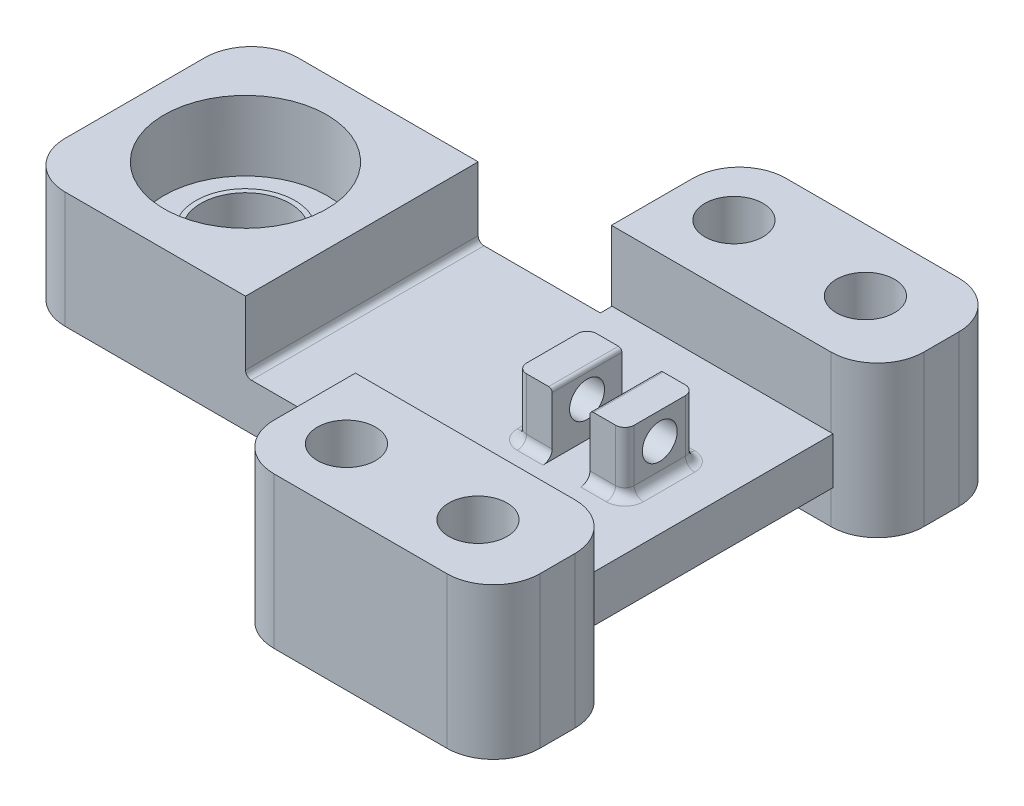
from build123d import *

# Parameters (mm, degrees)
SKETCH2_W            = 49
SKETCH2_H            = 20
BOSS_EXTRUDE1_DEPTH  = 10
SKETCH3_W            = 30
SKETCH3_H            = 3.02
CUT_EXTRUDE1_DEPTH   = 2
SKETCH4_W            = 5
SKETCH4_H            = 6
CUT_EXTRUDE2_DEPTH   = 5
SKETCH5_R            = 7
CUT_EXTRUDE3_DEPTH   = 38.474986727
SKETCH12_W           = 5
SKETCH12_H           = 6
BOSS_EXTRUDE4_DEPTH  = 0.8
SKETCH14_W           = 29.5
SKETCH14_H           = 6
CUT_EXTRUDE6_DEPTH   = 42.177221974
SKETCH20_W           = 5
SKETCH20_H           = 6
BOSS_EXTRUDE6_DEPTH  = 4.2
SKETCH21_R           = 4.6
CUT_EXTRUDE8_DEPTH   = 0.5
SKETCH22_R           = 3.825
CUT_EXTRUDE9_DEPTH   = 4
SKETCH24_R           = 4.6
SKETCH24_R_2         = 4.25
CUT_EXTRUDE11_DEPTH  = 1
BOSS_EXTRUDE9_START  = 0.5
SKETCH26_R           = 4.25
SKETCH26_R_2         = 3.825
BOSS_EXTRUDE9_DEPTH  = 0.5
SKETCH27_R           = 7
SKETCH27_R_2         = 4.6
CUT_EXTRUDE12_DEPTH  = 1
FILLET1_R            = 0.5
SKETCH56_R           = 2
CUT_EXTRUDE13_DEPTH  = 2
SKETCH57_W           = 3
SKETCH57_H           = 6
BOSS_EXTRUDE19_DEPTH = 5.3
CUT_EXTRUDE14_REACH  = 50.148
SKETCH58_R           = 1.5
FILLET2_R            = 0.3
FILLET3_R            = 0.8
SKETCH60_W           = 19
SKETCH60_H           = 4
BOSS_EXTRUDE21_DEPTH = 1
SKETCH59_W           = 22.86
SKETCH59_H           = 13
BOSS_EXTRUDE20_DEPTH = 11
CUT_EXTRUDE15_REACH  = 49.914
SKETCH61_R           = 2.5
FILLET4_R            = 4


with BuildPart() as part:
    # Sketch2 → Boss-Extrude1 (new body)
    with BuildSketch(Plane(origin=(0, 0, 0), x_dir=(1, 0, 0), z_dir=(0, 1, 0))):
        with Locations((10.076923077, 3.557692308)):
            Rectangle(SKETCH2_W, SKETCH2_H)
    extrude(amount=BOSS_EXTRUDE1_DEPTH)

    # Sketch3 → Cut-Extrude1 (cut)
    with BuildSketch(Plane.XZ):
        with Locations((12.576923077, -3.557692308)):
            Rectangle(SKETCH3_W, SKETCH3_H)
    extrude(amount=-CUT_EXTRUDE1_DEPTH, mode=Mode.SUBTRACT)

    # Sketch4 → Cut-Extrude2 (cut)
    with BuildSketch(Plane.XZ):
        with Locations((-4.923076923, -3.547692308)):
            Rectangle(SKETCH4_W, SKETCH4_H)
    extrude(amount=-CUT_EXTRUDE2_DEPTH, mode=Mode.SUBTRACT)

    # Sketch5 → Cut-Extrude3 (cut, through all)
    with BuildSketch(Plane.XZ.offset(-5)):
        with Locations(Location((-4.923076923, -3.552692308, 0), (0, 0, 270))):
            Circle(SKETCH5_R)
    extrude(amount=-CUT_EXTRUDE3_DEPTH, mode=Mode.SUBTRACT)

    # Sketch12 → Boss-Extrude4 (add)
    with BuildSketch(Plane.XZ):
        with Locations((-4.923076923, -3.547692308)):
            Rectangle(SKETCH12_W, SKETCH12_H)
    extrude(amount=-BOSS_EXTRUDE4_DEPTH)

    # Sketch14 → Cut-Extrude6 (cut, through all)
    with BuildSketch(Plane.XY.offset(6.442307692)):
        with Locations((19.826923077, 7)):
            Rectangle(SKETCH14_W, SKETCH14_H)
    extrude(amount=-CUT_EXTRUDE6_DEPTH, mode=Mode.SUBTRACT)

    # Sketch20 → Boss-Extrude6 (add)
    with BuildSketch(Plane(origin=(0, 0.8, 0), x_dir=(1, 0, 0), z_dir=(0, 1, 0))):
        with Locations((-4.923076923, 3.547692308)):
            Rectangle(SKETCH20_W, SKETCH20_H)
    extrude(amount=BOSS_EXTRUDE6_DEPTH)

    # Sketch21 → Cut-Extrude8 (cut)
    with BuildSketch(Plane(origin=(0, 5, 0), x_dir=(1, 0, 0), z_dir=(0, 1, 0))):
        with Locations(Location((-4.923076923, 3.552692308, 0), (0, 0, 270))):
            Circle(SKETCH21_R)
    extrude(amount=-CUT_EXTRUDE8_DEPTH, mode=Mode.SUBTRACT)

    # Sketch22 → Cut-Extrude9 (cut)
    with BuildSketch(Plane(origin=(0, 4.5, 0), x_dir=(1, 0, 0), z_dir=(0, 1, 0))):
        with Locations(Location((-4.923076923, 3.552692308, 0), (0, 0, 270))):
            Circle(SKETCH22_R)
    extrude(amount=-CUT_EXTRUDE9_DEPTH, mode=Mode.SUBTRACT)

    # Sketch24 → Cut-Extrude11 (cut)
    with BuildSketch(Plane(origin=(0, 5, 0), x_dir=(1, 0, 0), z_dir=(0, 1, 0))):
        with Locations(Location((-4.923076923, 3.552692308, 0), (0, 0, 270))):
            Circle(SKETCH24_R)
        with Locations(Location((-4.923076923, 3.552692308, 0), (0, 0, 270))):
            Circle(SKETCH24_R_2, mode=Mode.SUBTRACT)
    extrude(amount=-CUT_EXTRUDE11_DEPTH, mode=Mode.SUBTRACT)

    # Sketch26 → Boss-Extrude9 (add)
    with BuildSketch(Plane(origin=(0, 4.5, 0), x_dir=(1, 0, 0), z_dir=(0, 1, 0)).offset(BOSS_EXTRUDE9_START)):
        with Locations(Location((-4.923076923, 3.552692308, 0), (0, 0, 270))):
            Circle(SKETCH26_R)
        with Locations(Location((-4.923076923, 3.552692308, 0), (0, 0, 270))):
            Circle(SKETCH26_R_2, mode=Mode.SUBTRACT)
    extrude(amount=-BOSS_EXTRUDE9_DEPTH)

    # Sketch27 → Cut-Extrude12 (cut)
    with BuildSketch(Plane(origin=(0, 5, 0), x_dir=(1, 0, 0), z_dir=(0, 1, 0))):
        with Locations(Location((-4.923076923, 3.552692308, 0), (0, 0, 90))):
            Circle(SKETCH27_R)
        with Locations((-4.923076923, 3.552692308)):
            Circle(SKETCH27_R_2, mode=Mode.SUBTRACT)
    extrude(amount=-CUT_EXTRUDE12_DEPTH, mode=Mode.SUBTRACT)

    # Fillet1
    fillet1_edges = [part.edges().sort_by_distance(p)[0] for p in [
        (5.076923077, 4, -3.557692308),
    ]]
    fillet(fillet1_edges, radius=FILLET1_R)

    # Sketch56 → Cut-Extrude13 (cut)
    with BuildSketch(Plane.XZ):
        with Locations((28.926923077, -3.557692308)):
            Circle(SKETCH56_R)
    extrude(amount=-CUT_EXTRUDE13_DEPTH, mode=Mode.SUBTRACT)

    # Sketch57 → Boss-Extrude19 (add)
    with BuildSketch(Plane(origin=(0, 4, 0), x_dir=(1, 0, 0), z_dir=(0, 1, 0))):
        with Locations((29.181923077, 3.557692308)):
            Rectangle(SKETCH57_W, SKETCH57_H)
        with Locations((22.931923077, 3.557692308)):
            Rectangle(SKETCH57_W, SKETCH57_H)
    extrude(amount=BOSS_EXTRUDE19_DEPTH)

    # Cut-Extrude14: up to this face of the body (flat: up to its plane)
    cut_extrude14_end = Plane(part.part.faces().sort_by_distance((21.431923077, 6.65, -3.557692308))[0])
    # Sketch58 → Cut-Extrude14 (cut, up to the picked face)
    with BuildSketch(Plane(origin=(30.681923077, 0, 0), x_dir=(0, 0, -1), z_dir=(1, 0, 0)), mode=Mode.PRIVATE) as cut_extrude14_sk1:
        with Locations(Location((3.557692308, 7, 0), (0, 0, 180))):
            Circle(SKETCH58_R)
    cut_extrude14_tool1 = split(extrude(cut_extrude14_sk1.sketch, amount=-CUT_EXTRUDE14_REACH, mode=Mode.PRIVATE), bisect_by=cut_extrude14_end, keep=Keep.BOTH, mode=Mode.PRIVATE)
    add(cut_extrude14_tool1.solids().sort_by(Axis((30.681923, 7, -3.557692), (-1, 0, 0)))[0], mode=Mode.SUBTRACT)

    # Fillet2
    fillet2_edges = [part.edges().sort_by_distance(p)[0] for p in [
        (27.681923077, 9.3, -3.557692308),
        (24.431923077, 9.3, -3.557692308),
    ]]
    fillet(fillet2_edges, radius=FILLET2_R)

    # Fillet3
    fillet3_edges = [part.edges().sort_by_distance(p)[0] for p in [
        (30.681923077, 4, -3.557692308),
        (30.681923077, 6.65, -0.557692308),
        (29.181923077, 4, -6.557692308),
        (30.681923077, 6.65, -6.557692308),
        (29.181923077, 4, -0.557692308),
        (21.431923077, 6.65, -6.557692308),
        (21.431923077, 6.65, -0.557692308),
        (22.931923077, 4, -6.557692308),
        (21.431923077, 4, -3.557692308),
        (22.931923077, 4, -0.557692308),
    ]]
    fillet(fillet3_edges, radius=FILLET3_R)

    # Sketch60 → Boss-Extrude21 (add)
    with BuildSketch(Plane(origin=(0, 0, -13.557692308), x_dir=(-1, 0, 0), z_dir=(0, 0, -1))):
        with Locations((-25.076923077, 2)):
            Rectangle(SKETCH60_W, SKETCH60_H)
    boss_extrude21 = extrude(amount=BOSS_EXTRUDE21_DEPTH)

    # Sketch59 → Boss-Extrude20 (add)
    with BuildSketch(Plane(origin=(0, 0, -14.557692308), x_dir=(-1, 0, 0), z_dir=(0, 0, -1))):
        with Locations((-26.956923077, 3.5)):
            Rectangle(SKETCH59_W, SKETCH59_H)
    boss_extrude20 = extrude(amount=BOSS_EXTRUDE20_DEPTH)

    # Mirror4: Boss-Extrude21, Boss-Extrude20 across plane
    add(boss_extrude21.mirror(Plane(origin=(0, 0, -3.557692308), x_dir=(1, 0, 0), z_dir=(0, 0, -1))))
    add(boss_extrude20.mirror(Plane(origin=(0, 0, -3.557692308), x_dir=(1, 0, 0), z_dir=(0, 0, -1))))

    # Sketch61 → Cut-Extrude15 (cut, up to next)
    with BuildSketch(Plane(origin=(0, 10, 0), x_dir=(1, 0, 0), z_dir=(0, 1, 0)), mode=Mode.PRIVATE) as cut_extrude15_sk1:
        with Locations(Location((20.406923077, 20.207692308, 0), (0, 0, 270))):
            Circle(SKETCH61_R)
    cut_extrude15_tool1 = extrude(cut_extrude15_sk1.sketch, amount=-CUT_EXTRUDE15_REACH, mode=Mode.PRIVATE) & part.part
    # Sketch61 → Cut-Extrude15 (cut, up to next)
    with BuildSketch(Plane(origin=(0, 10, 0), x_dir=(1, 0, 0), z_dir=(0, 1, 0)), mode=Mode.PRIVATE) as cut_extrude15_sk2:
        with Locations(Location((31.706923077, 20.207692308, 0), (0, 0, 270))):
            Circle(SKETCH61_R)
    cut_extrude15_tool2 = extrude(cut_extrude15_sk2.sketch, amount=-CUT_EXTRUDE15_REACH, mode=Mode.PRIVATE) & part.part
    # Sketch61 → Cut-Extrude15 (cut, up to next)
    with BuildSketch(Plane(origin=(0, 10, 0), x_dir=(1, 0, 0), z_dir=(0, 1, 0)), mode=Mode.PRIVATE) as cut_extrude15_sk3:
        with Locations(Location((31.706923077, -13.092307692, 0), (0, 0, 90))):
            Circle(SKETCH61_R)
    cut_extrude15_tool3 = extrude(cut_extrude15_sk3.sketch, amount=-CUT_EXTRUDE15_REACH, mode=Mode.PRIVATE) & part.part
    # Sketch61 → Cut-Extrude15 (cut, up to next)
    with BuildSketch(Plane(origin=(0, 10, 0), x_dir=(1, 0, 0), z_dir=(0, 1, 0)), mode=Mode.PRIVATE) as cut_extrude15_sk4:
        with Locations(Location((20.406923077, -13.092307692, 0), (0, 0, 90))):
            Circle(SKETCH61_R)
    cut_extrude15_tool4 = extrude(cut_extrude15_sk4.sketch, amount=-CUT_EXTRUDE15_REACH, mode=Mode.PRIVATE) & part.part
    add(cut_extrude15_tool1.solids().sort_by_distance((20.406923, 10, -20.207692))[0], mode=Mode.SUBTRACT)
    add(cut_extrude15_tool2.solids().sort_by_distance((31.706923, 10, -20.207692))[0], mode=Mode.SUBTRACT)
    add(cut_extrude15_tool3.solids().sort_by_distance((31.706923, 10, 13.092308))[0], mode=Mode.SUBTRACT)
    add(cut_extrude15_tool4.solids().sort_by_distance((20.406923, 10, 13.092308))[0], mode=Mode.SUBTRACT)

    # Fillet4
    # the kernel refuses this fillet: 4 mm, written as the material it takes off along each edge
    with BuildSketch(Plane(origin=(38.386923077, 20, -25.557692308), x_dir=(0, 0, 1), z_dir=(0, -1, 0)), Plane(origin=(15.526923077, -13, 18.442307692), x_dir=(1, 0, 0), z_dir=(0, 1, 0)), Plane(origin=(15.526923077, -13, -25.557692308), x_dir=(0, 0, 1), z_dir=(0, 1, 0))) as fillet4_piece_1:
        with BuildLine():
            CenterArc((FILLET4_R, FILLET4_R), FILLET4_R, 180, 90)
            Line((0, FILLET4_R), (0, 0))
            Line((0, 0), (FILLET4_R, 0))
        make_face()
    extrude(amount=33, mode=Mode.SUBTRACT)
    with BuildSketch(Plane(origin=(38.386923077, 20, 7.442307692), x_dir=(0, 0, 1), z_dir=(0, -1, 0))) as fillet4_piece_2_section:
        with BuildLine():
            CenterArc((FILLET4_R, FILLET4_R), FILLET4_R, 180, 90)
            Line((0, FILLET4_R), (0, 0))
            Line((0, 0), (FILLET4_R, 0))
        make_face()
    fillet4_piece_2 = extrude(amount=33, mode=Mode.PRIVATE)
    fillet4_piece_2 = split(fillet4_piece_2, bisect_by=Plane(origin=(34.576923077, 12, 8.351487897), z_dir=(1, 0, 0)), keep=Keep.TOP, mode=Mode.PRIVATE)
    fillet4_piece_2 = split(fillet4_piece_2, bisect_by=Plane(origin=(37.49276705, 4, 8.351487897), z_dir=(0, 1, 0)), keep=Keep.TOP, mode=Mode.PRIVATE)
    add(fillet4_piece_2, mode=Mode.SUBTRACT)
    with BuildSketch(Plane(origin=(38.386923077, 20, 7.442307692), x_dir=(0, 0, 1), z_dir=(0, -1, 0))) as fillet4_piece_3_section:
        with BuildLine():
            CenterArc((FILLET4_R, FILLET4_R), FILLET4_R, 180, 90)
            Line((0, FILLET4_R), (0, 0))
            Line((0, 0), (FILLET4_R, 0))
        make_face()
    fillet4_piece_3 = extrude(amount=33, mode=Mode.PRIVATE)
    fillet4_piece_3 = split(fillet4_piece_3, bisect_by=Plane(origin=(34.576923077, 12, 7.403071145), z_dir=(-1, 0, 0)), keep=Keep.TOP, mode=Mode.PRIVATE)
    fillet4_piece_3 = split(fillet4_piece_3, bisect_by=Plane(origin=(34.482800084, 4, 7.403071145), z_dir=(0, 1, 0)), keep=Keep.TOP, mode=Mode.PRIVATE)
    add(fillet4_piece_3, mode=Mode.SUBTRACT)
    with BuildSketch(Plane(origin=(38.386923077, 20, 7.442307692), x_dir=(0, 0, 1), z_dir=(0, -1, 0))) as fillet4_piece_4_section:
        with BuildLine():
            CenterArc((FILLET4_R, FILLET4_R), FILLET4_R, 180, 90)
            Line((0, FILLET4_R), (0, 0))
            Line((0, 0), (FILLET4_R, 0))
        make_face()
    fillet4_piece_4 = extrude(amount=33, mode=Mode.PRIVATE)
    fillet4_piece_4 = split(fillet4_piece_4, bisect_by=Plane(origin=(34.576923077, 2, 8.351487897), z_dir=(1, 0, 0)), keep=Keep.TOP, mode=Mode.PRIVATE)
    fillet4_piece_4 = split(fillet4_piece_4, bisect_by=Plane(origin=(37.49276705, 0, 8.351487897), z_dir=(0, 1, 0)), keep=Keep.TOP, mode=Mode.PRIVATE)
    fillet4_piece_4 = split(fillet4_piece_4, bisect_by=Plane(origin=(37.49276705, 4, 8.351487897), z_dir=(0, -1, 0)), keep=Keep.TOP, mode=Mode.PRIVATE)
    add(fillet4_piece_4, mode=Mode.SUBTRACT)
    with BuildSketch(Plane(origin=(38.386923077, 20, 7.442307692), x_dir=(0, 0, 1), z_dir=(0, -1, 0))) as fillet4_piece_5_section:
        with BuildLine():
            CenterArc((FILLET4_R, FILLET4_R), FILLET4_R, 180, 90)
            Line((0, FILLET4_R), (0, 0))
            Line((0, 0), (FILLET4_R, 0))
        make_face()
    fillet4_piece_5 = extrude(amount=33, mode=Mode.PRIVATE)
    fillet4_piece_5 = split(fillet4_piece_5, bisect_by=Plane(origin=(34.576923077, -6.5, 8.351487897), z_dir=(1, 0, 0)), keep=Keep.TOP, mode=Mode.PRIVATE)
    fillet4_piece_5 = split(fillet4_piece_5, bisect_by=Plane(origin=(37.49276705, 0, 8.351487897), z_dir=(0, -1, 0)), keep=Keep.TOP, mode=Mode.PRIVATE)
    add(fillet4_piece_5, mode=Mode.SUBTRACT)
    with BuildSketch(Plane(origin=(38.386923077, 20, 7.442307692), x_dir=(0, 0, 1), z_dir=(0, -1, 0))) as fillet4_piece_6_section:
        with BuildLine():
            CenterArc((FILLET4_R, FILLET4_R), FILLET4_R, 180, 90)
            Line((0, FILLET4_R), (0, 0))
            Line((0, 0), (FILLET4_R, 0))
        make_face()
    fillet4_piece_6 = extrude(amount=33, mode=Mode.PRIVATE)
    fillet4_piece_6 = split(fillet4_piece_6, bisect_by=Plane(origin=(34.576923077, -6.5, 7.403071145), z_dir=(-1, 0, 0)), keep=Keep.TOP, mode=Mode.PRIVATE)
    fillet4_piece_6 = split(fillet4_piece_6, bisect_by=Plane(origin=(34.482800084, 0, 7.403071145), z_dir=(0, -1, 0)), keep=Keep.TOP, mode=Mode.PRIVATE)
    add(fillet4_piece_6, mode=Mode.SUBTRACT)
    with BuildSketch(Plane(origin=(38.386923077, 20, 18.442307692), x_dir=(0, 0, -1), z_dir=(0, -1, 0))) as fillet4_piece_7:
        with BuildLine():
            CenterArc((FILLET4_R, -FILLET4_R), FILLET4_R, 90, 90)
            Line((0, -FILLET4_R), (0, 0))
            Line((0, 0), (FILLET4_R, 0))
        make_face()
    extrude(amount=33, mode=Mode.SUBTRACT)
    with BuildSketch(Plane(origin=(-14.423076923, -10, -13.557692308), x_dir=(1, 0, 0), z_dir=(0, 1, 0))) as fillet4_piece_8:
        with BuildLine():
            CenterArc((FILLET4_R, -FILLET4_R), FILLET4_R, 90, 90)
            Line((0, -FILLET4_R), (0, 0))
            Line((0, 0), (FILLET4_R, 0))
        make_face()
    extrude(amount=30, mode=Mode.SUBTRACT)
    with BuildSketch(Plane(origin=(-14.423076923, -10, 6.442307692), x_dir=(1, 0, 0), z_dir=(0, 1, 0))) as fillet4_piece_9:
        with BuildLine():
            CenterArc((FILLET4_R, FILLET4_R), FILLET4_R, 180, 90)
            Line((0, FILLET4_R), (0, 0))
            Line((0, 0), (FILLET4_R, 0))
        make_face()
    extrude(amount=30, mode=Mode.SUBTRACT)
    with BuildSketch(Plane(origin=(38.386923077, 20, -14.557692308), x_dir=(-1, 0, 0), z_dir=(0, -1, 0))) as fillet4_piece_10_section:
        with BuildLine():
            CenterArc((FILLET4_R, FILLET4_R), FILLET4_R, 180, 90)
            Line((0, FILLET4_R), (0, 0))
            Line((0, 0), (FILLET4_R, 0))
        make_face()
    fillet4_piece_10 = extrude(amount=33, mode=Mode.PRIVATE)
    fillet4_piece_10 = split(fillet4_piece_10, bisect_by=Plane(origin=(34.576923077, 12, -14.51845576), z_dir=(-1, 0, 0)), keep=Keep.TOP, mode=Mode.PRIVATE)
    fillet4_piece_10 = split(fillet4_piece_10, bisect_by=Plane(origin=(34.482800084, 4, -14.51845576), z_dir=(0, 1, 0)), keep=Keep.TOP, mode=Mode.PRIVATE)
    add(fillet4_piece_10, mode=Mode.SUBTRACT)
    with BuildSketch(Plane(origin=(38.386923077, 20, -14.557692308), x_dir=(-1, 0, 0), z_dir=(0, -1, 0))) as fillet4_piece_11_section:
        with BuildLine():
            CenterArc((FILLET4_R, FILLET4_R), FILLET4_R, 180, 90)
            Line((0, FILLET4_R), (0, 0))
            Line((0, 0), (FILLET4_R, 0))
        make_face()
    fillet4_piece_11 = extrude(amount=33, mode=Mode.PRIVATE)
    fillet4_piece_11 = split(fillet4_piece_11, bisect_by=Plane(origin=(34.576923077, 12, -15.466872512), z_dir=(1, 0, 0)), keep=Keep.TOP, mode=Mode.PRIVATE)
    fillet4_piece_11 = split(fillet4_piece_11, bisect_by=Plane(origin=(37.49276705, 4, -15.466872512), z_dir=(0, 1, 0)), keep=Keep.TOP, mode=Mode.PRIVATE)
    add(fillet4_piece_11, mode=Mode.SUBTRACT)
    with BuildSketch(Plane(origin=(38.386923077, 20, -14.557692308), x_dir=(-1, 0, 0), z_dir=(0, -1, 0))) as fillet4_piece_12_section:
        with BuildLine():
            CenterArc((FILLET4_R, FILLET4_R), FILLET4_R, 180, 90)
            Line((0, FILLET4_R), (0, 0))
            Line((0, 0), (FILLET4_R, 0))
        make_face()
    fillet4_piece_12 = extrude(amount=33, mode=Mode.PRIVATE)
    fillet4_piece_12 = split(fillet4_piece_12, bisect_by=Plane(origin=(34.576923077, 2, -15.466872512), z_dir=(1, 0, 0)), keep=Keep.TOP, mode=Mode.PRIVATE)
    fillet4_piece_12 = split(fillet4_piece_12, bisect_by=Plane(origin=(37.49276705, 0, -15.466872512), z_dir=(0, 1, 0)), keep=Keep.TOP, mode=Mode.PRIVATE)
    fillet4_piece_12 = split(fillet4_piece_12, bisect_by=Plane(origin=(37.49276705, 4, -15.466872512), z_dir=(0, -1, 0)), keep=Keep.TOP, mode=Mode.PRIVATE)
    add(fillet4_piece_12, mode=Mode.SUBTRACT)
    with BuildSketch(Plane(origin=(38.386923077, 20, -14.557692308), x_dir=(-1, 0, 0), z_dir=(0, -1, 0))) as fillet4_piece_13_section:
        with BuildLine():
            CenterArc((FILLET4_R, FILLET4_R), FILLET4_R, 180, 90)
            Line((0, FILLET4_R), (0, 0))
            Line((0, 0), (FILLET4_R, 0))
        make_face()
    fillet4_piece_13 = extrude(amount=33, mode=Mode.PRIVATE)
    fillet4_piece_13 = split(fillet4_piece_13, bisect_by=Plane(origin=(34.576923077, -6.5, -14.51845576), z_dir=(-1, 0, 0)), keep=Keep.TOP, mode=Mode.PRIVATE)
    fillet4_piece_13 = split(fillet4_piece_13, bisect_by=Plane(origin=(34.482800084, 0, -14.51845576), z_dir=(0, -1, 0)), keep=Keep.TOP, mode=Mode.PRIVATE)
    add(fillet4_piece_13, mode=Mode.SUBTRACT)
    with BuildSketch(Plane(origin=(38.386923077, 20, -14.557692308), x_dir=(-1, 0, 0), z_dir=(0, -1, 0))) as fillet4_piece_14_section:
        with BuildLine():
            CenterArc((FILLET4_R, FILLET4_R), FILLET4_R, 180, 90)
            Line((0, FILLET4_R), (0, 0))
            Line((0, 0), (FILLET4_R, 0))
        make_face()
    fillet4_piece_14 = extrude(amount=33, mode=Mode.PRIVATE)
    fillet4_piece_14 = split(fillet4_piece_14, bisect_by=Plane(origin=(34.576923077, -6.5, -15.466872512), z_dir=(1, 0, 0)), keep=Keep.TOP, mode=Mode.PRIVATE)
    fillet4_piece_14 = split(fillet4_piece_14, bisect_by=Plane(origin=(37.49276705, 0, -15.466872512), z_dir=(0, -1, 0)), keep=Keep.TOP, mode=Mode.PRIVATE)
    add(fillet4_piece_14, mode=Mode.SUBTRACT)


solid = part.part
